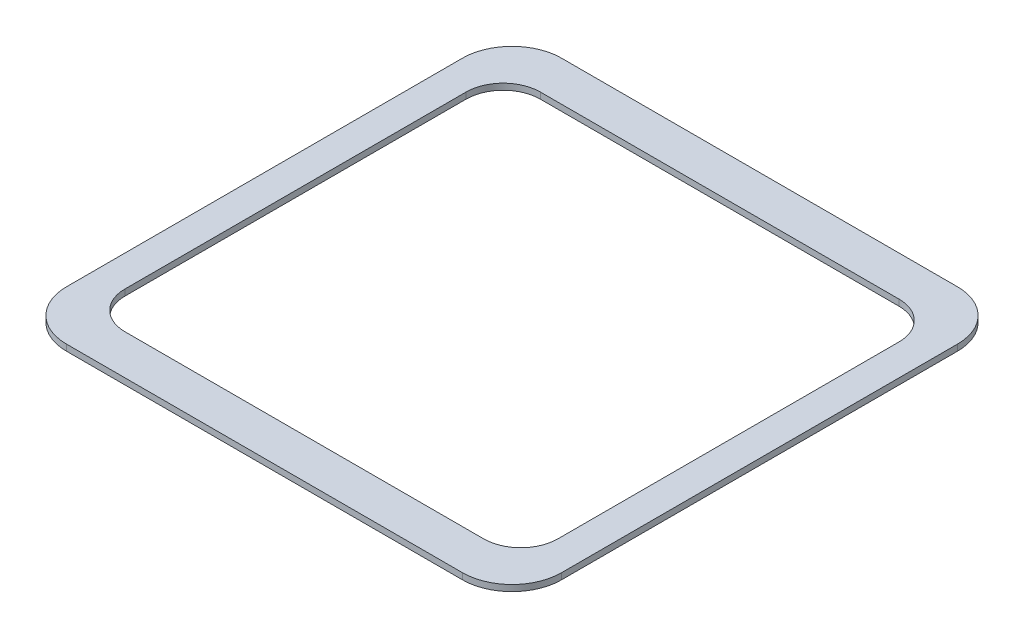
from build123d import *

# Parameters (mm, degrees)
MAINBODY_DEPTH = 1.5875


with BuildPart() as part:
    # Sketch2 → MainBody (new body)
    with BuildSketch(Plane(origin=(0, 49.034568419, 0), x_dir=(1, 0, 0), z_dir=(0, 1, 0))):
        with BuildLine():
            Line((36.612473168, 86.646627483), (-64.987526832, 86.646627483))
            ThreePointArc((-64.987526832, 86.646627483), (-73.967782953, 82.926883604), (-77.687526832, 73.946627483))
            Line((-77.687526832, 73.946627483), (-77.687526832, -27.653372517))
            ThreePointArc((-77.687526832, -27.653372517), (-73.967782953, -36.633628639), (-64.987526832, -40.353372517))
            Line((-64.987526832, -40.353372517), (36.612473168, -40.353372517))
            ThreePointArc((36.612473168, -40.353372517), (45.592729289, -36.633628639), (49.312473168, -27.653372517))
            Line((49.312473168, -27.653372517), (49.312473168, 73.946627483))
            ThreePointArc((49.312473168, 73.946627483), (45.592729289, 82.926883604), (36.612473168, 86.646627483))
        make_face()
        with BuildLine():
            Line((41.328422375, -20.592172517), (41.328422375, 66.885427483))
            ThreePointArc((41.328422375, 66.885427483), (38.53898644, 73.619721548), (31.804692375, 76.409157483))
            Line((31.804692375, 76.409157483), (-60.179746039, 76.409157483))
            ThreePointArc((-60.179746039, 76.409157483), (-66.914040104, 73.619721548), (-69.703476039, 66.885427483))
            Line((-69.703476039, 66.885427483), (-69.703476039, 23.146627483))
            Line((-69.703476039, 23.146627483), (-69.703476039, -20.592172517))
            ThreePointArc((-69.703476039, -20.592172517), (-66.914040104, -27.326466583), (-60.179746039, -30.115902517))
            Line((-60.179746039, -30.115902517), (31.804692375, -30.115902517))
            ThreePointArc((31.804692375, -30.115902517), (38.53898644, -27.326466583), (41.328422375, -20.592172517))
        make_face(mode=Mode.SUBTRACT)
    extrude(amount=MAINBODY_DEPTH)


solid = part.part
